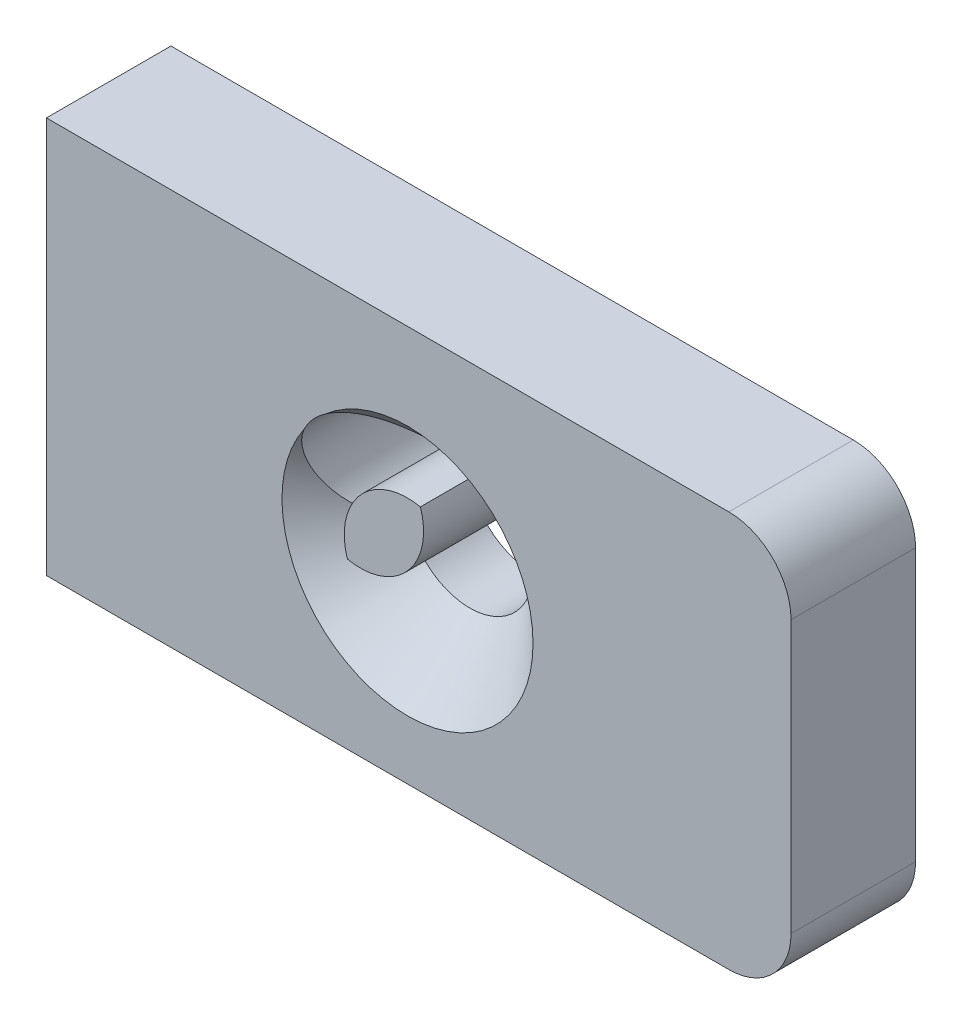
from build123d import *

# Parameters (mm, degrees)
SKETCH1_W           = 119.597938106
SKETCH1_H           = 63.665281708
BOSS_EXTRUDE1_DEPTH = 20
FILLET1_R           = 10
FILLET2_R           = 10
CUT_EXTRUDE1_DEPTH  = 20
CHAMFER1_SIZE       = 10


with BuildPart() as part:
    # Sketch1 → Boss-Extrude1 (new body)
    with BuildSketch(Plane.XY):
        with Locations((1.804279239, 2.190910504)):
            Rectangle(SKETCH1_W, SKETCH1_H)
    extrude(amount=BOSS_EXTRUDE1_DEPTH)

    # Fillet1
    fillet1_edges = [part.edges().sort_by_distance(p)[0] for p in [
        (61.603248292, 34.023551358, 10),
    ]]
    fillet(fillet1_edges, radius=FILLET1_R)

    # Fillet2
    fillet2_edges = [part.edges().sort_by_distance(p)[0] for p in [
        (61.603248292, -29.64173035, 10),
    ]]
    fillet(fillet2_edges, radius=FILLET2_R)

    # Sketch2 → Cut-Extrude1 (cut)
    with BuildSketch(Plane.XY.offset(20)):
        with BuildLine():
            ThreePointArc((-9.649869077, -3.18172058), (7.580385389, -6.766171474), (2.069483688, 9.947892054))
            ThreePointArc((2.069483688, 9.947892054), (0, 0), (-9.649869077, -3.18172058))
        make_face()
        with BuildLine():
            ThreePointArc((-9.649869077, -3.18172058), (-7.580385389, 6.766171474), (2.069483688, 9.947892054))
            ThreePointArc((2.069483688, 9.947892054), (-15.160770777, 13.532342947), (-9.649869077, -3.18172058))
        make_face()
    extrude(amount=-CUT_EXTRUDE1_DEPTH, mode=Mode.SUBTRACT)

    # Chamfer1
    # the kernel refuses this chamfer: 10 mm, written as the material it takes off along each edge
    with BuildSketch(Plane(origin=(0, 0, 20), x_dir=(-0.7481252128924886, 0.6635575829078957, 0), z_dir=(0.6635575829078957, 0.7481252128924886, 0))) as chamfer1_piece_1:
        Polygon((10.160871963, -CHAMFER1_SIZE), (10.160871963 + CHAMFER1_SIZE, 0), (10.160871963, 0), align=None)
    revolve(axis=Axis((0, 0, 20), (0, 0, 1)), revolution_arc=359.64, mode=Mode.SUBTRACT)


solid = part.part
